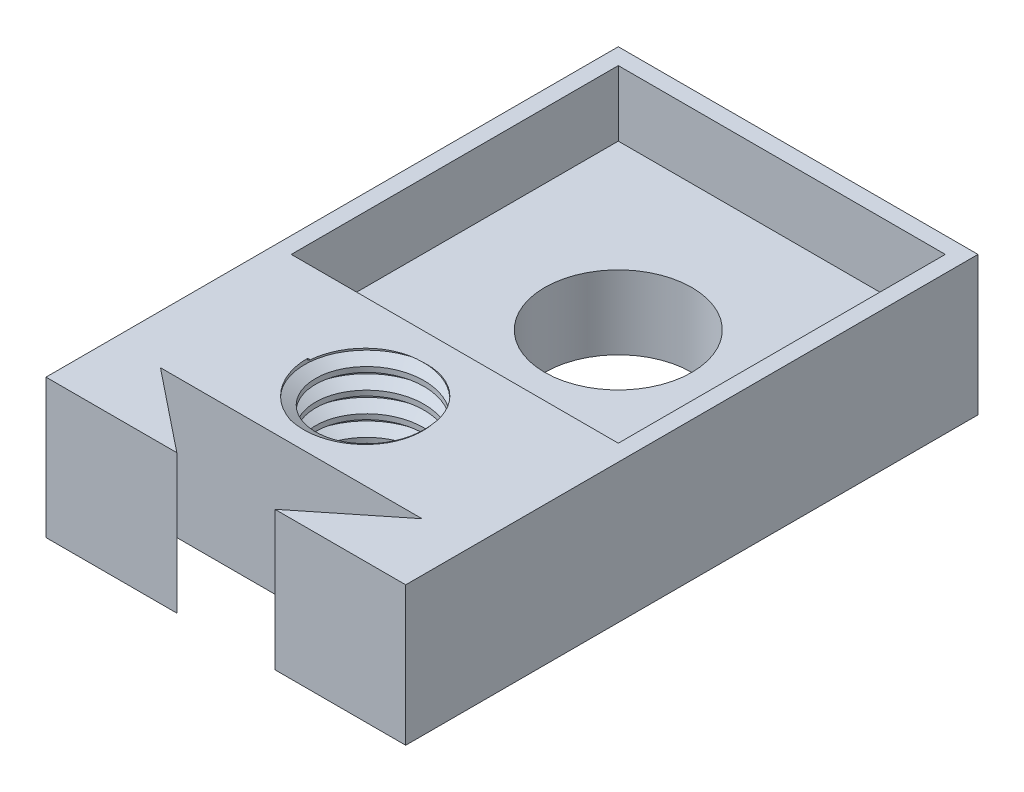
from build123d import *

# Parameters (mm, degrees)
BOSS_EXTRUDE1_DEPTH      = 5
BOSS_EXTRUDE1_DEPTH_BACK = 3.5
SKETCH1_W                = 22
SKETCH1_H                = 22
SKETCH1_W_2              = 20
SKETCH1_H_2              = 20
BOSS_EXTRUDE2_DEPTH      = 1
BOSS_EXTRUDE2_DEPTH_BACK = 3.5
SKETCH1_2_W              = 20
SKETCH1_2_H              = 20
SKETCH2_R                = 4.5
CUT_EXTRUDE1_DEPTH       = 7
BOSS_EXTRUDE4_DEPTH      = 5
BOSS_EXTRUDE4_DEPTH_BACK = 3.5
SKETCH4_R                = 4
CUT_EXTRUDE2_DEPTH       = 10
THREAD1_PITCH            = 1.25
THREAD1_FROM             = 1
THREAD1_TO               = 9.5


with BuildPart() as part:
    # Sketch1 → Boss-Extrude1 (new, two sides: drawn at the far end of the back side and taken through both)
    with BuildSketch(Plane(origin=(0, 0, 0), x_dir=(1, 0, 0), z_dir=(0, 1, 0)).offset(-BOSS_EXTRUDE1_DEPTH_BACK)):
        Rectangle(SKETCH1_W, SKETCH1_H)
        Rectangle(SKETCH1_W_2, SKETCH1_H_2, mode=Mode.SUBTRACT)
    extrude(amount=BOSS_EXTRUDE1_DEPTH + BOSS_EXTRUDE1_DEPTH_BACK)

    # Sketch1<2> → Boss-Extrude2 (add, two sides: drawn at the far end of the back side and taken through both)
    with BuildSketch(Plane(origin=(0, 0, 0), x_dir=(1, 0, 0), z_dir=(0, 1, 0)).offset(-BOSS_EXTRUDE2_DEPTH_BACK)):
        Rectangle(SKETCH1_2_W, SKETCH1_2_H)
    extrude(amount=BOSS_EXTRUDE2_DEPTH + BOSS_EXTRUDE2_DEPTH_BACK)

    # Sketch2 → Cut-Extrude1 (cut)
    with BuildSketch(Plane.XZ.offset(3.5)):
        with Locations(Location((0, 0, 0), (0, 0, 270))):
            Circle(SKETCH2_R)
    extrude(amount=-CUT_EXTRUDE1_DEPTH, mode=Mode.SUBTRACT)

    # Sketch3 → Boss-Extrude4 (add, two sides: drawn at the far end of the back side and taken through both)
    with BuildSketch(Plane(origin=(0, 0, 0), x_dir=(1, 0, 0), z_dir=(0, 1, 0)).offset(-BOSS_EXTRUDE4_DEPTH_BACK)):
        Polygon((11, -11), (-11, -11), (-11, -24), (-3, -24), (-8, -20), (8, -20), (3, -24), (11, -24), align=None)
    extrude(amount=BOSS_EXTRUDE4_DEPTH + BOSS_EXTRUDE4_DEPTH_BACK)

    # Sketch4 → Cut-Extrude2 (cut)
    with BuildSketch(Plane(origin=(0, 5, 0), x_dir=(1, 0, 0), z_dir=(0, 1, 0))):
        with Locations(Location((0, -15, 0), (0, 0, 270))):
            Circle(SKETCH4_R)
    extrude(amount=-CUT_EXTRUDE2_DEPTH, mode=Mode.SUBTRACT)

    # Thread1: arcs per turn and ends read off the stored shape
    # Thread1: the profile of Thread Profile2 profile screwed along a right-hand helix through 8 turns, 8 arcs to a turn; built about Z, then put on its axis
    thread1_z = Axis((0, 0, 0), (0, 0, 1))
    thread1_corners = [(4.0003, 0, -0.000173205), (4.0003, 0, 1.093923202), (3.323417656, 0, 0.703124998), (3.323417656, 0, 0.390624998)]
    with BuildLine(mode=Mode.PRIVATE) as thread1_profile:
        Line(thread1_corners[0], thread1_corners[1])
        Line(thread1_corners[1], thread1_corners[2])
        Line(thread1_corners[2], thread1_corners[3])
        Line(thread1_corners[3], thread1_corners[0])
    thread1_cap = Face(thread1_profile.wire())
    thread1_turn_angles = [0, 22.5, 45, 67.5, 90, 112.5, 135, 157.5, 180, 202.5, 225, 247.5, 270, 292.5, 315, 337.5, 360]
    thread1_turn_weights = [1, 0.9238795325112867, 1, 0.9238795325112867, 1, 0.9238795325112867, 1, 0.9238795325112867, 1, 0.9238795325112867, 1, 0.9238795325112867, 1, 0.9238795325112867, 1, 0.9238795325112867, 1]
    thread1_turn_rails = [Edge.make_bspline([Vector(p[0], p[1], 0).rotate(thread1_z, thread1_turn_angles[k]) / thread1_turn_weights[k] + Vector(0, 0, p[2] + THREAD1_PITCH * thread1_turn_angles[k] / 360) for k in range(17)], [0, 0, 0, 1, 1, 2, 2, 3, 3, 4, 4, 5, 5, 6, 6, 7, 7, 8, 8, 8], 2, thread1_turn_weights) for p in thread1_corners]
    thread1_turn_sides = [Face.make_surface_from_curves(thread1_turn_rails[p[0]], thread1_turn_rails[p[1]]) for p in [(0, 1), (1, 2), (2, 3), (3, 0)]]
    thread1 = Plane(origin=(0, 6, 15), x_dir=(-1, 0, 0), z_dir=(0, -1, 0)) * split(split(Solid(Shell([*[p.moved(Location((0, 0, THREAD1_PITCH * i))) for i in range(8) for p in thread1_turn_sides], thread1_cap, thread1_cap.rotate(thread1_z, 2880).moved(Location((0, 0, THREAD1_PITCH * 2880 / 360)))])), bisect_by=Plane.XY.offset(THREAD1_FROM), keep=Keep.TOP, mode=Mode.PRIVATE), bisect_by=Plane.XY.offset(THREAD1_TO), keep=Keep.BOTTOM, mode=Mode.PRIVATE)
    add(thread1)


solid = part.part
